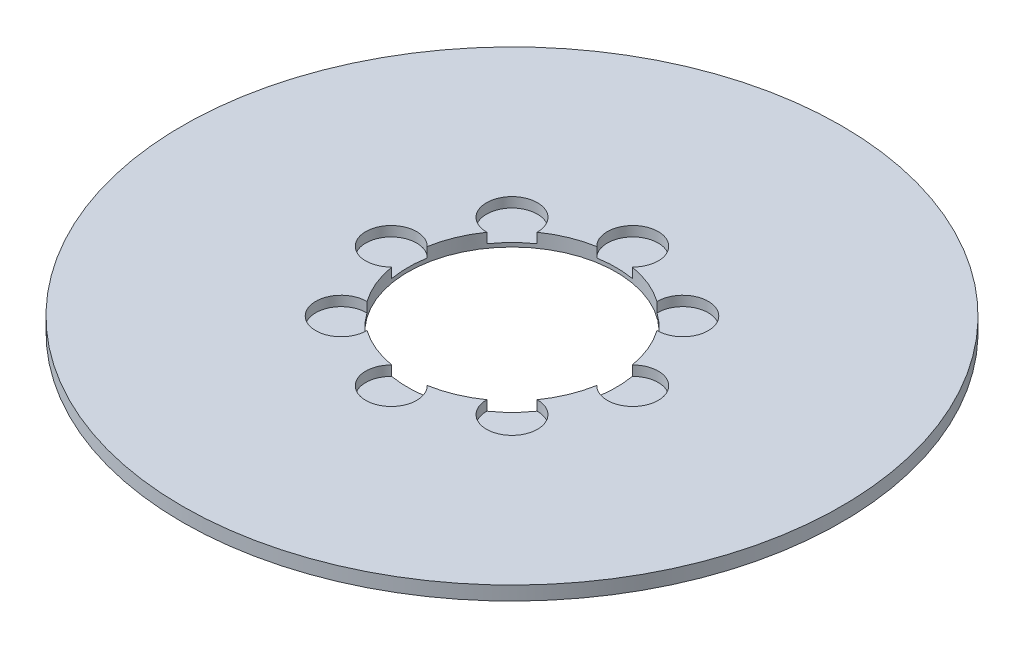
from build123d import *

# Parameters (mm, degrees)
SKETCH1_R           = 95
BOSS_EXTRUDE1_DEPTH = 4
SKETCH2_R           = 30
CUT_EXTRUDE1_DEPTH  = 135.40982107
SKETCH3_R           = 7.335507771
CUT_EXTRUDE2_DEPTH  = 2.860970943
CIRPATTERN1_COUNT   = 8


with BuildPart() as part:
    # Sketch1 → Boss-Extrude1 (new body)
    with BuildSketch(Plane(origin=(0, 0, 0), x_dir=(1, 0, 0), z_dir=(0, 1, 0))):
        Circle(SKETCH1_R)
    extrude(amount=BOSS_EXTRUDE1_DEPTH)

    # Sketch2 → Cut-Extrude1 (cut, through all)
    with BuildSketch(Plane(origin=(0, 0, 0), x_dir=(1, 0, 0), z_dir=(0, 1, 0))):
        Circle(SKETCH2_R)
    extrude(amount=CUT_EXTRUDE1_DEPTH, mode=Mode.SUBTRACT)

    # Sketch3 → Cut-Extrude2 (cut)
    with BuildSketch(Plane(origin=(0, 4, 0), x_dir=(1, 0, 0), z_dir=(0, 1, 0))):
        with Locations((-34.817566877, 0)):
            Circle(SKETCH3_R)
    cut_extrude2 = extrude(amount=-CUT_EXTRUDE2_DEPTH, mode=Mode.SUBTRACT)

    # CirPattern1: Cut-Extrude2 ×8 about axis
    cirpattern1_axis = Axis((0, 0, 0), (0, 1, 0))
    for i in range(1, CIRPATTERN1_COUNT):
        add(cut_extrude2.rotate(cirpattern1_axis, i * 360 / CIRPATTERN1_COUNT), mode=Mode.SUBTRACT)


solid = part.part
